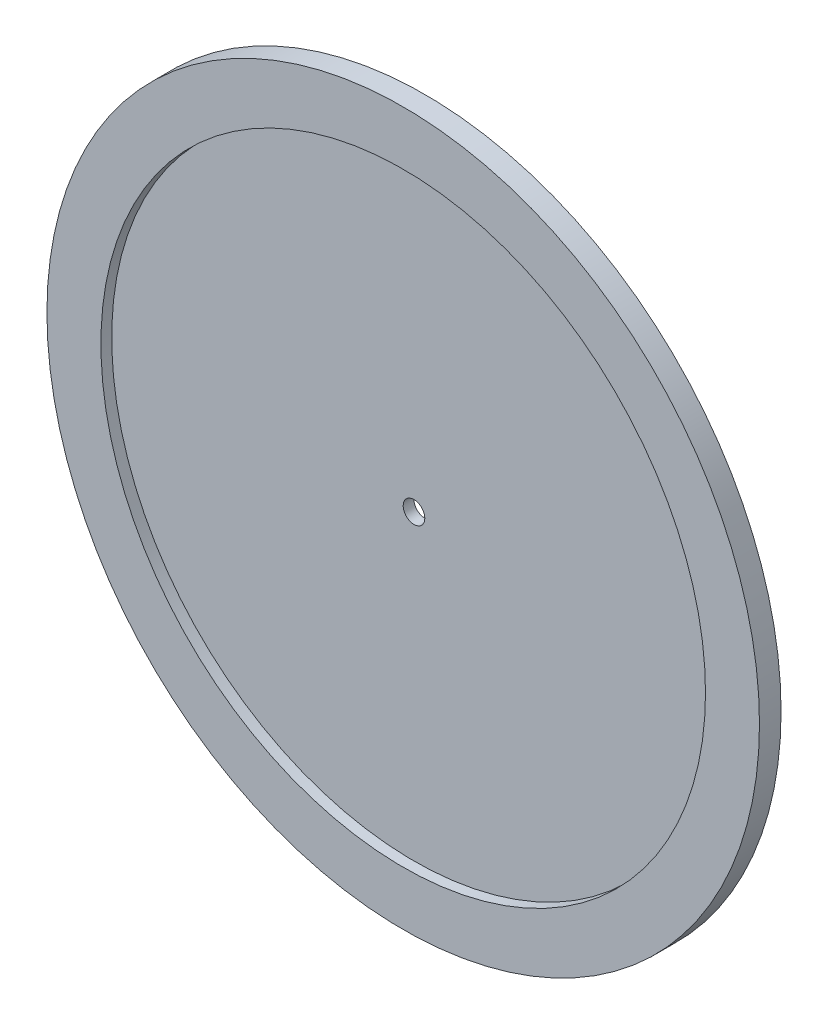
from build123d import *

# Parameters (mm, degrees)
SKETCH1_R      = 104.775
RADIUS_DEPTH   = 6.35
SKETCH3_R      = 3.175
EXTRUDE3_DEPTH = 149.310228069
SKETCH4_R      = 88.9
EXTRUDE4_DEPTH = 3.175


with BuildPart() as part:
    # Sketch1 → Radius (new body)
    with BuildSketch(Plane.XY):
        Circle(SKETCH1_R)
    extrude(amount=RADIUS_DEPTH)

    # Sketch3 → Extrude3 (cut, through all)
    with BuildSketch(Plane.XY.offset(6.35)):
        Circle(SKETCH3_R)
    extrude(amount=-EXTRUDE3_DEPTH, mode=Mode.SUBTRACT)

    # Sketch4 → Extrude4 (cut)
    with BuildSketch(Plane.XY.offset(6.35)):
        Circle(SKETCH4_R)
    extrude(amount=-EXTRUDE4_DEPTH, mode=Mode.SUBTRACT)


solid = part.part
